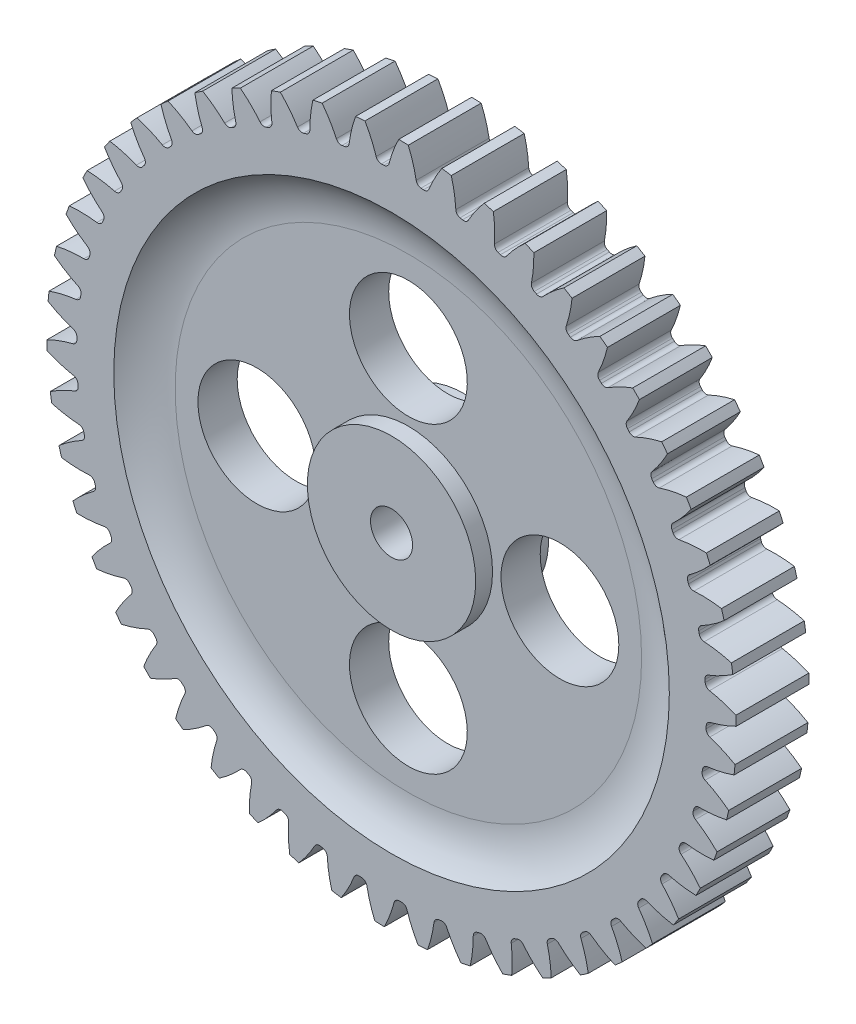
from build123d import *

# Parameters (mm, degrees)
SKETCH3_R          = 26
GEARBODY_DEPTH     = 5.499999998
TOOTHCUT_DEPTH     = 38.17862289
CIRPATTERN1_COUNT  = 50
BOREDIA_R          = 1.5875
BORE_DEPTH         = 12700
SKETCH4_R          = 20.955
SKETCH4_R_2        = 6.35
CUT_EXTRUDE1_DEPTH = 1.27
CUT_EXTRUDE2_START = -1.27
SKETCH5_R          = 20.955
SKETCH5_R_2        = 6.35
CUT_EXTRUDE2_DEPTH = 1.27
FILLET2_R          = 5.08
SKETCH6_R          = 4.445
CUT_EXTRUDE3_DEPTH = 38.006183625
CIRPATTERN2_COUNT  = 4


with BuildPart() as part:
    # Sketch3 → gearBody (new body)
    with BuildSketch(Plane.XY):
        with Locations(Location((0, 0, 0), (0, 0, 180))):
            Circle(SKETCH3_R)
    extrude(amount=GEARBODY_DEPTH)

    # Sketch2 → toothCut (cut, through all)
    with BuildSketch(Plane.XY):
        with BuildLine():
            ThreePointArc((23.731397627, -0.91938419), (23.734871798, -0.824840213), (23.737969314, -0.730283147))
            ThreePointArc((23.737969314, -0.730283147), (23.82750333, -0.488292555), (24.044845282, -0.349230473))
            ThreePointArc((24.044845282, -0.349230473), (27.21103988, 1.092273746), (29.658276585, 3.564874635))
            ThreePointArc((29.658276585, 3.564874635), (29.853732217, -1.037484384), (29.339249323, -5.615171442))
            ThreePointArc((29.339249323, -5.615171442), (27.069566222, -2.978646974), (24.011080321, -1.320821097))
            ThreePointArc((24.011080321, -1.320821097), (23.803916493, -1.167006485), (23.731397627, -0.91938419))
        make_face()
    toothcut = extrude(amount=TOOTHCUT_DEPTH, mode=Mode.SUBTRACT)

    # CirPattern1: toothCut ×50 about axis
    cirpattern1_axis = Axis((0, 0, 0), (0, 0, 1))
    for i in range(1, CIRPATTERN1_COUNT):
        add(toothcut.rotate(cirpattern1_axis, i * 360 / CIRPATTERN1_COUNT), mode=Mode.SUBTRACT)

    # boreDia → bore (cut, symmetric)
    with BuildSketch(Plane.XY):
        Circle(BOREDIA_R)
    extrude(amount=BORE_DEPTH, both=True, mode=Mode.SUBTRACT)

    # Sketch4 → Cut-Extrude1 (cut)
    with BuildSketch(Plane.XY.offset(5.499999998)):
        Circle(SKETCH4_R)
        Circle(SKETCH4_R_2, mode=Mode.SUBTRACT)
    extrude(amount=-CUT_EXTRUDE1_DEPTH, mode=Mode.SUBTRACT)

    # Sketch5 → Cut-Extrude2 (cut)
    with BuildSketch(Plane(origin=(0, 0, 0), x_dir=(-1, 0, 0), z_dir=(0, 0, -1)).offset(CUT_EXTRUDE2_START)):
        with Locations(Location((0, 0, 0), (0, 0, 180))):
            Circle(SKETCH5_R)
        with Locations(Location((0, 0, 0), (0, 0, 180))):
            Circle(SKETCH5_R_2, mode=Mode.SUBTRACT)
    extrude(amount=CUT_EXTRUDE2_DEPTH, mode=Mode.SUBTRACT)

    # Fillet2
    # the kernel refuses this fillet: 5.08 mm, written as the material it adds along each edge
    with BuildSketch(Plane(origin=(0, 0, 4.229999998), x_dir=(1, 0, 0), z_dir=(0, -1, 0))) as fillet2_piece_1:
        with BuildLine():
            CenterArc((17.594895835, 5.08), FILLET2_R, 270, 41.409622109)
            Line((17.594895835, 0), (17.594895835, -0.1016))
            Line((17.594895835, -0.1016), (20.955, -0.1016))
            Line((20.955, -0.1016), (21.0566, 0))
            ThreePointArc((21.0566, 0), (21.0566, 0.635), (21.022202083, 1.1938))
            Line((21.022202083, 1.1938), (20.955, 1.27))
        make_face()
    revolve(axis=Axis((0, 0, 4.229999998), (0, 0, 1)))
    with BuildSketch(Plane(origin=(0, 0, 1.27), x_dir=(1, 0, 0), z_dir=(0, 1, 0))) as fillet2_piece_2:
        with BuildLine():
            CenterArc((17.594895835, 5.08), FILLET2_R, 270, 41.409622109)
            Line((17.594895835, 0), (17.594895835, -0.1016))
            Line((17.594895835, -0.1016), (20.955, -0.1016))
            Line((20.955, -0.1016), (21.0566, 0))
            ThreePointArc((21.0566, 0), (21.0566, 0.635), (21.022202083, 1.1938))
            Line((21.022202083, 1.1938), (20.955, 1.27))
        make_face()
    revolve(axis=Axis((0, 0, 1.27), (0, 0, -1)))

    # Sketch6 → Cut-Extrude3 (cut, through all)
    with BuildSketch(Plane.XY.offset(4.229999998)):
        with Locations((11.43, 0)):
            Circle(SKETCH6_R)
    cut_extrude3 = extrude(amount=-CUT_EXTRUDE3_DEPTH, mode=Mode.SUBTRACT)

    # CirPattern2: Cut-Extrude3 ×4 about axis
    cirpattern2_axis = Axis((0, 0, 0), (0, 0, 1))
    for i in range(1, CIRPATTERN2_COUNT):
        add(cut_extrude3.rotate(cirpattern2_axis, i * 360 / CIRPATTERN2_COUNT), mode=Mode.SUBTRACT)


solid = part.part
